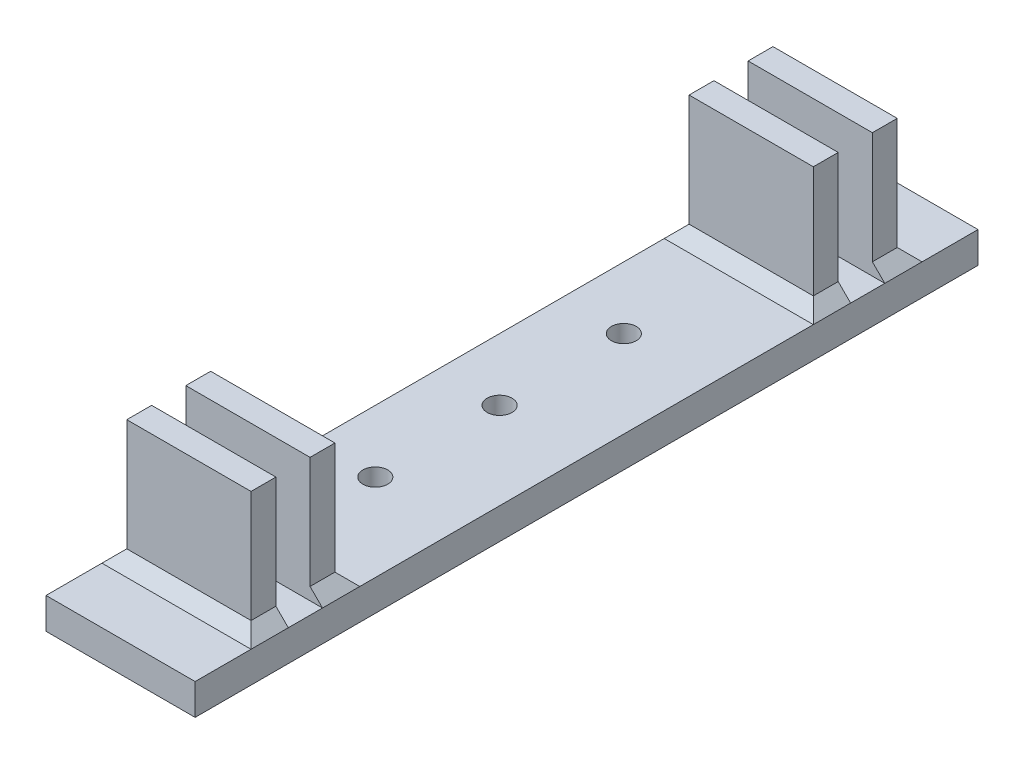
from build123d import *

# Parameters (mm, degrees)
SKETCH1_W               = 24
SKETCH1_H               = 126
BOSS_EXTRUDE1_DEPTH     = 5
SKETCH2_W               = 20
SKETCH2_H               = 4
BOSS_EXTRUDE2_DEPTH     = 20
CUT_EXTRUDE1_DEPTH      = 123.736336331
CUT_EXTRUDE1_DEPTH_BACK = 123.736336331
SKETCH3_R               = 2
CHAMFER1_SIZE           = 2


with BuildPart() as part:
    # Sketch1 → Boss-Extrude1 (new body)
    with BuildSketch(Plane(origin=(0, 0, 0), x_dir=(1, 0, 0), z_dir=(0, 1, 0))):
        with Locations((-62.650887574, -32.349112426)):
            Rectangle(SKETCH1_W, SKETCH1_H)
    extrude(amount=BOSS_EXTRUDE1_DEPTH)

    # Sketch2 → Boss-Extrude2 (add)
    with BuildSketch(Plane(origin=(0, 5, 0), x_dir=(1, 0, 0), z_dir=(0, 1, 0))):
        with Locations((-62.650887574, 17.650887574)):
            Rectangle(SKETCH2_W, SKETCH2_H)
        with Locations((-62.650887574, 8.150887574)):
            Rectangle(SKETCH2_W, SKETCH2_H)
        with Locations((-62.650887574, -72.849112426)):
            Rectangle(SKETCH2_W, SKETCH2_H)
        with Locations((-62.650887574, -82.349112426)):
            Rectangle(SKETCH2_W, SKETCH2_H)
    extrude(amount=BOSS_EXTRUDE2_DEPTH)

    # Sketch3 → Cut-Extrude1 (cut, two sides: drawn at the far end of the back side and taken through both)
    with BuildSketch(Plane(origin=(0, 5, 0), x_dir=(1, 0, 0), z_dir=(0, 1, 0)).offset(-CUT_EXTRUDE1_DEPTH_BACK)):
        with Locations(Location((-64.650887574, -32.349112426, 0), (0, 0, 270))):
            Circle(SKETCH3_R)
        with Locations(Location((-64.650887574, -12.349112426, 0), (0, 0, 270))):
            Circle(SKETCH3_R)
        with Locations(Location((-64.650887574, -52.349112426, 0), (0, 0, 270))):
            Circle(SKETCH3_R)
    extrude(amount=CUT_EXTRUDE1_DEPTH + CUT_EXTRUDE1_DEPTH_BACK, mode=Mode.SUBTRACT)

    # Chamfer1
    chamfer1_edges = [part.edges().sort_by_distance(p)[0] for p in [
        (-72.650887574, 5, -17.650887574),
        (-52.650887574, 5, -17.650887574),
        (-62.650887574, 5, -19.650887574),
        (-72.650887574, 5, -8.150887574),
        (-62.650887574, 5, -6.150887574),
        (-52.650887574, 5, -8.150887574),
        (-72.650887574, 5, 82.349112426),
        (-62.650887574, 5, 84.349112426),
        (-52.650887574, 5, 82.349112426),
        (-62.650887574, 5, 70.849112426),
        (-72.650887574, 5, 72.849112426),
        (-52.650887574, 5, 72.849112426),
    ]]
    chamfer(chamfer1_edges, length=CHAMFER1_SIZE - 0.0001)  # a hair under: the kernel refuses the full size


solid = part.part
